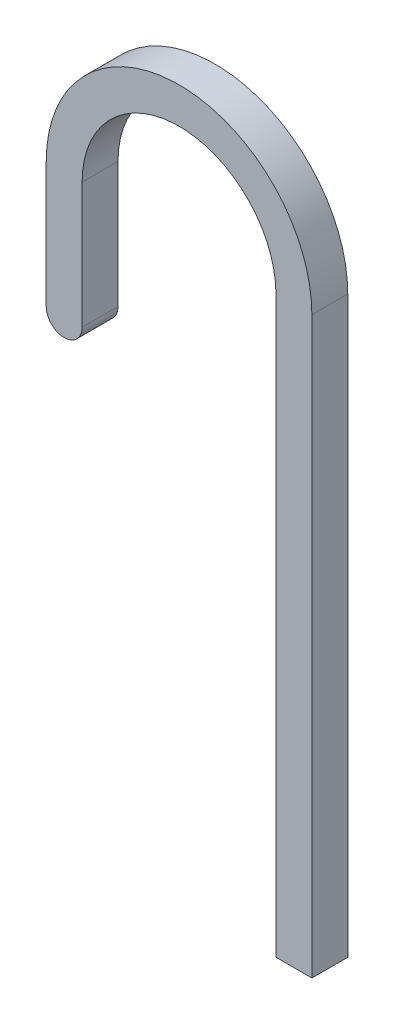
from build123d import *

# Parameters (mm, degrees)
BOSS_EXTRUDE1_DEPTH = 12.7
FILLET3_R           = 6.35
FILLET4_R           = 6.35


with BuildPart() as part:
    # Sketch5 → Boss-Extrude1 (new body)
    with BuildSketch(Plane.XY):
        with BuildLine():
            Line((0, 0), (12.7, 0))
            Line((12.7, 0), (12.7, 203.2))
            ThreePointArc((12.7, 203.2), (-34.29, 250.19), (-81.28, 203.2))
            Line((-81.28, 203.2), (-81.28, 152.4))
            Line((-81.28, 152.4), (-68.58, 152.4))
            Line((-68.58, 152.4), (-68.58, 203.2))
            ThreePointArc((-68.58, 203.2), (-34.29, 237.49), (0, 203.2))
            Line((0, 203.2), (0, 0))
        make_face()
    extrude(amount=BOSS_EXTRUDE1_DEPTH)

    # Fillet3
    fillet3_edges = [part.edges().sort_by_distance(p)[0] for p in [
        (-68.58, 152.4, 6.35),
    ]]
    fillet(fillet3_edges, radius=FILLET3_R)

    # Fillet4
    fillet4_edges = [part.edges().sort_by_distance(p)[0] for p in [
        (-81.28, 152.4, 6.35),
    ]]
    fillet(fillet4_edges, radius=FILLET4_R - 0.0001)  # a hair under: the kernel refuses the full size


solid = part.part
